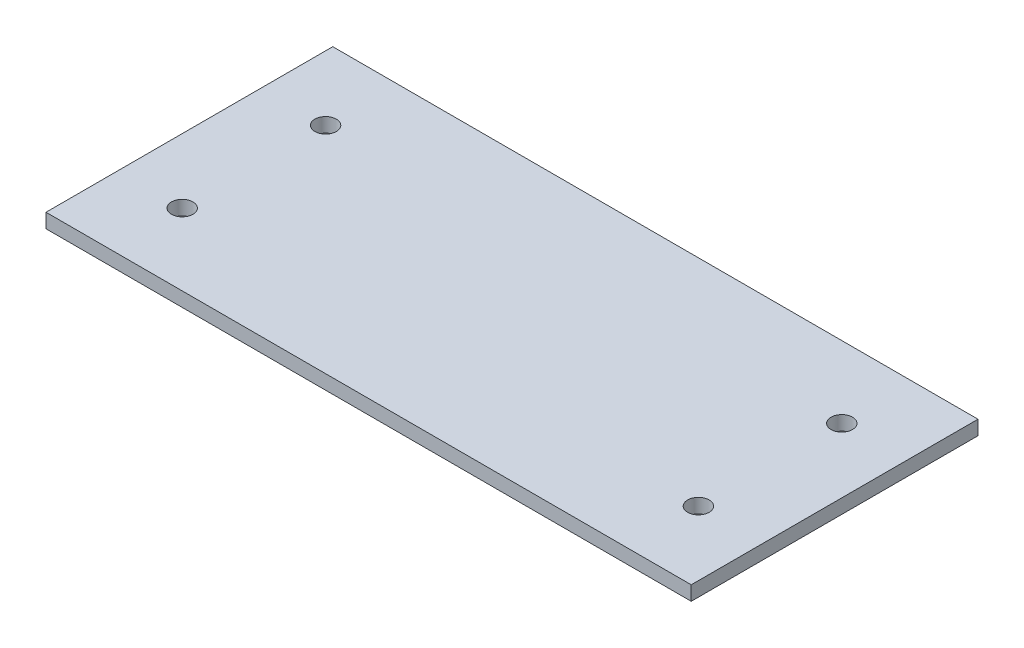
from build123d import *

# Parameters (mm, degrees)
SKETCH1_W           = 90
SKETCH1_H           = 40
SKETCH1_R           = 1.5
BOSS_EXTRUDE1_DEPTH = 2


with BuildPart() as part:
    # Sketch1 → Boss-Extrude1 (new body)
    with BuildSketch(Plane(origin=(0, 0, 0), x_dir=(1, 0, 0), z_dir=(0, 1, 0))):
        Rectangle(SKETCH1_W, SKETCH1_H)
        with Locations((36, 10)):
            Circle(SKETCH1_R, mode=Mode.SUBTRACT)
        with Locations((36, -10)):
            Circle(SKETCH1_R, mode=Mode.SUBTRACT)
        with Locations((-36, -10)):
            Circle(SKETCH1_R, mode=Mode.SUBTRACT)
        with Locations((-36, 10)):
            Circle(SKETCH1_R, mode=Mode.SUBTRACT)
    extrude(amount=BOSS_EXTRUDE1_DEPTH)


solid = part.part
